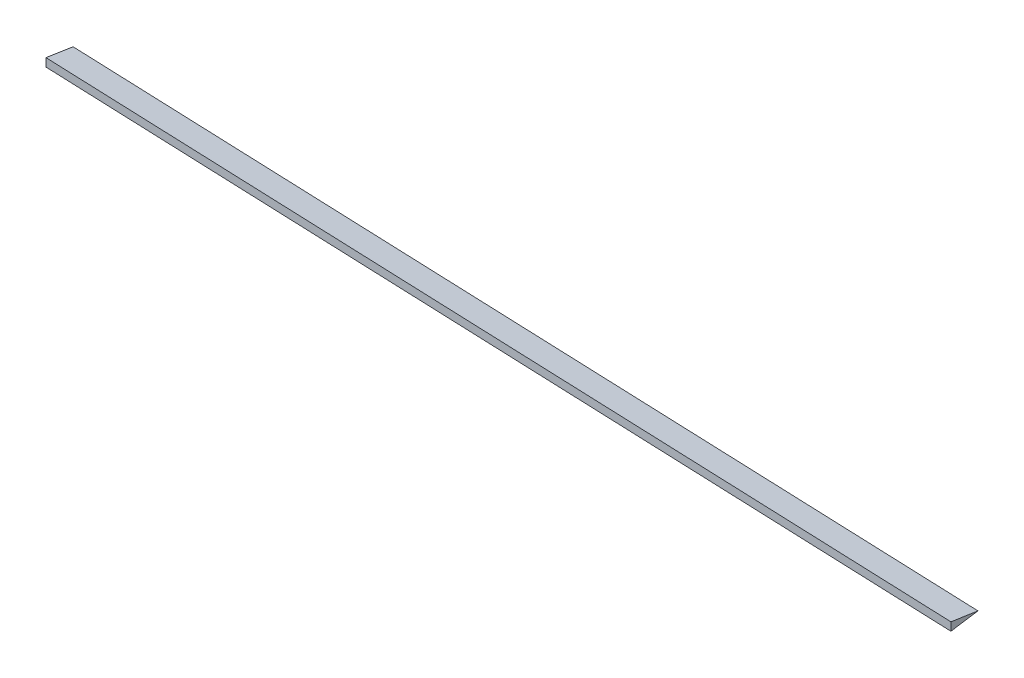
from build123d import *

# Parameters (mm, degrees)
AILERON_DEPTH = 1042.635027375


with BuildPart() as part:
    # aileron_root → aileron (new, along a direction that is not the sketch's normal)
    with BuildSketch(Plane(origin=(0, 0, 0), x_dir=(0, 0, -1), z_dir=(1, 0, 0))):
        Polygon((-30, -4.53107134), (-30, 4.53107134), (0, 0), align=None)
    extrude(amount=AILERON_DEPTH, dir=(0.9992638178994815, 0, 0.03836433548169344))


solid = part.part
